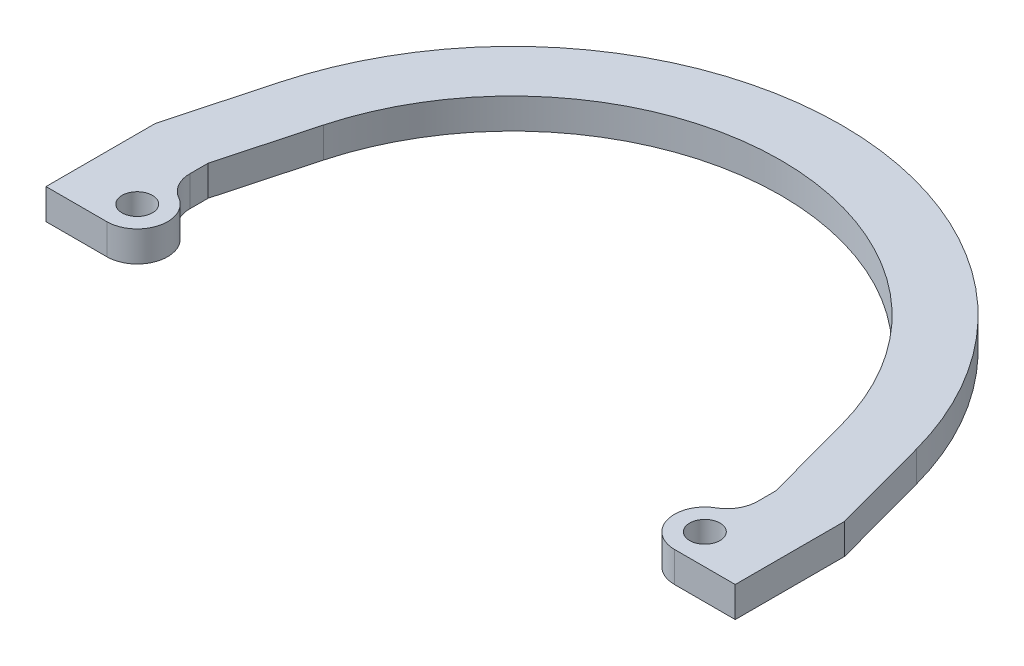
from build123d import *

# Parameters (mm, degrees)
EYELID_OUTLINE_R   = 1.25
EYELID_DEPTH       = 3
SKETCH1_R          = 1.5
SKETCH1_W          = 68
SKETCH1_H          = 13
CUT_EXTRUDE1_DEPTH = 48.130138977


# Read off the part's stored shape, not the designer's step: eyelid
with BuildPart() as part:
    # eyelid outline → eyelid (new body)
    with BuildSketch(Plane(origin=(0, 0, 0), x_dir=(1, 0, 0), z_dir=(0, 1, 0))):
        with BuildLine():
            Line((28, -2), (28, -3.803847577))
            ThreePointArc((28, -3.803847577), (27.598076211, -5.303847577), (26.5, -6.401923789))
            ThreePointArc((26.5, -6.401923789), (25.102222521, -9.776457136), (28, -12))
            Line((28, -12), (29.1, -12))
            Line((29.1, -12), (29.1, -16))
            Line((29.1, -16), (30.9, -25))
            Line((30.9, -25), (32.4, -25))
            Line((32.4, -25), (33.9, -23.5))
            Line((33.9, -23.5), (33.9, -22.5))
            Line((33.9, -22.5), (33.4, -22))
            Line((33.4, -22), (32.9, -21))
            Line((32.9, -21), (32.9, -12))
            Line((32.9, -12), (34, -12))
            Line((34, -12), (34, -1.200719678))
            Line((34, -1.200719678), (31.366635055, 8.507890769))
            ThreePointArc((31.366635055, 8.507890769), (0, 32.5), (-31.366635055, 8.507890769))
            Line((-31.366635055, 8.507890769), (-34, -1.200719678))
            Line((-34, -1.200719678), (-34, -12))
            Line((-34, -12), (-32.9, -12))
            Line((-32.9, -12), (-32.9, -21))
            Line((-32.9, -21), (-33.4, -22))
            Line((-33.4, -22), (-33.9, -22.5))
            Line((-33.9, -22.5), (-33.9, -23.5))
            Line((-33.9, -23.5), (-32.4, -25))
            Line((-32.4, -25), (-30.9, -25))
            Line((-30.9, -25), (-29.1, -16))
            Line((-29.1, -16), (-29.1, -12))
            Line((-29.1, -12), (-28, -12))
            ThreePointArc((-28, -12), (-25.102222521, -9.776457136), (-26.5, -6.401923789))
            ThreePointArc((-26.5, -6.401923789), (-27.598076211, -5.303847577), (-28, -3.803847577))
            Line((-28, -3.803847577), (-28, -2))
            Line((-28, -2), (-25.57587166, 6.937203242))
            ThreePointArc((-25.57587166, 6.937203242), (0, 26.5), (25.57587166, 6.937203242))
            Line((25.57587166, 6.937203242), (28, -2))
        make_face()
        with Locations((-28, -9)):
            Circle(EYELID_OUTLINE_R, mode=Mode.SUBTRACT)
        with Locations((28, -9)):
            Circle(EYELID_OUTLINE_R, mode=Mode.SUBTRACT)
    extrude(amount=EYELID_DEPTH)

    # Sketch1 → Cut-Extrude1 (cut, through all)
    with BuildSketch(Plane(origin=(0, 0, 0), x_dir=(1, 0, 0), z_dir=(0, 1, 0))):
        with Locations(Location((-28, -9, 0), (0, 0, 270))):
            Circle(SKETCH1_R)
        with Locations(Location((28, -9, 0), (0, 0, 270))):
            Circle(SKETCH1_R)
        with Locations((0, -18.5)):
            Rectangle(SKETCH1_W, SKETCH1_H)
    extrude(amount=CUT_EXTRUDE1_DEPTH, mode=Mode.SUBTRACT)


solid = part.part
